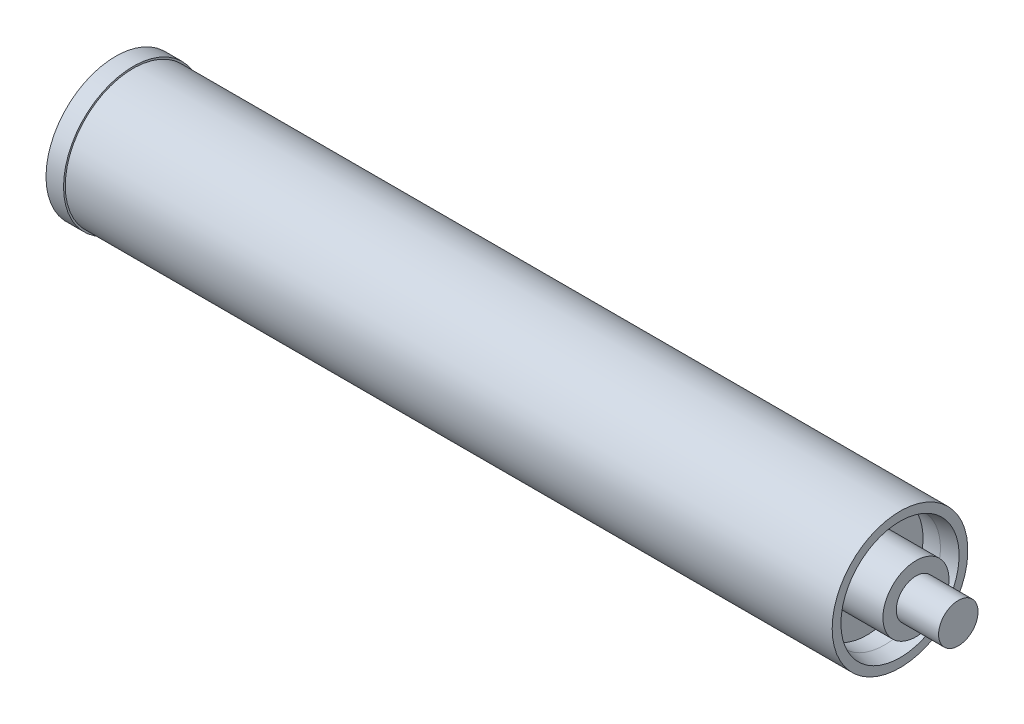
from build123d import *


with BuildPart() as part:
    # Esquisse2 → Révolution7 (revolve)
    with BuildSketch(Plane.XY):
        Polygon((0, 26), (12.7, 26), (36.56741584, 26), (36.56741584, 35.689138439), (25.4, 35.689138439), (12.7, 38.2095), (12.7, 50.419), (25.4, 50.419), (25.4, 49.149), (581.025, 49.149), (581.025, 42.820187711), (569.70214835, 40.573126289), (557.129618395, 40.573126289), (557.129618395, 23.9395), (592.597707907, 23.9395), (592.597707907, 14.2875), (623.2652, 14.2875), (623.2652, 0), (0, 0), align=None)
    revolve(axis=Axis((0, 0, 0), (1, 0, 0)))

    # Esquisse3 → Enlèvement de matière-Révolution1 (revolve, cut)
    with BuildSketch(Plane.XY):
        Polygon((0, 20), (0, 0), (557.129618395, 0), (557.129618395, 12.957757221), (539.779078227, 12.957757221), (539.779078227, 44.271024873), (65.871878934, 44.271024873), (34.08300614, 14.327580407), (19.08300614, 14.327580407), align=None)
    revolve(axis=Axis((0, 0, 0), (1, 0, 0)), mode=Mode.SUBTRACT)


solid = part.part
